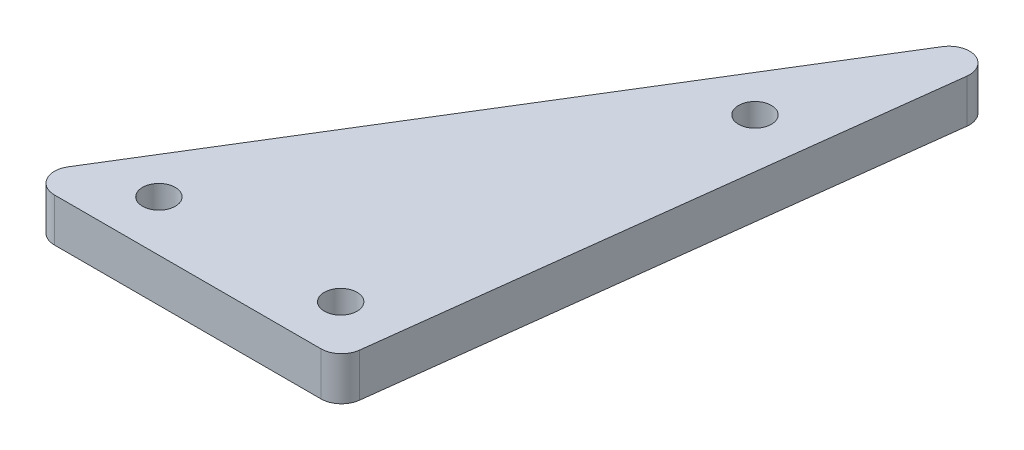
from build123d import *

# Parameters (mm, degrees)
BOSS_EXTRUDE1_DEPTH = 6.35
SKETCH2_R           = 2.4
CUT_EXTRUDE1_DEPTH  = 103.686827993


with BuildPart() as part:
    # Sketch1 → Boss-Extrude1 (new body)
    with BuildSketch(Plane(origin=(0, 0, 0), x_dir=(1, 0, 0), z_dir=(0, 1, 0))):
        with BuildLine():
            Line((5.368406408, 0), (44.345824206, 0))
            ThreePointArc((44.345824206, 0), (46.333684351, 0.753132838), (47.323462661, 2.63439197))
            Line((47.323462661, 2.63439197), (57.040137924, 81.77036144))
            ThreePointArc((57.040137924, 81.77036144), (55.05416359, 84.967329968), (51.507452969, 83.708145472))
            Line((51.507452969, 83.708145472), (2.813359907, 4.572176002))
            ThreePointArc((2.813359907, 4.572176002), (2.749577661, 1.536532885), (5.368406408, 0))
        make_face()
    extrude(amount=BOSS_EXTRUDE1_DEPTH)

    # Sketch2 → Cut-Extrude1 (cut, through all)
    with BuildSketch(Plane(origin=(0, 6.35, 0), x_dir=(1, 0, 0), z_dir=(0, 1, 0))):
        with Locations((13.242069139, 7.4)):
            Circle(SKETCH2_R)
        with Locations((46.450610204, 61.369381637)):
            Circle(SKETCH2_R)
        with Locations((39.824003378, 7.4)):
            Circle(SKETCH2_R)
    extrude(amount=-CUT_EXTRUDE1_DEPTH, mode=Mode.SUBTRACT)


solid = part.part
